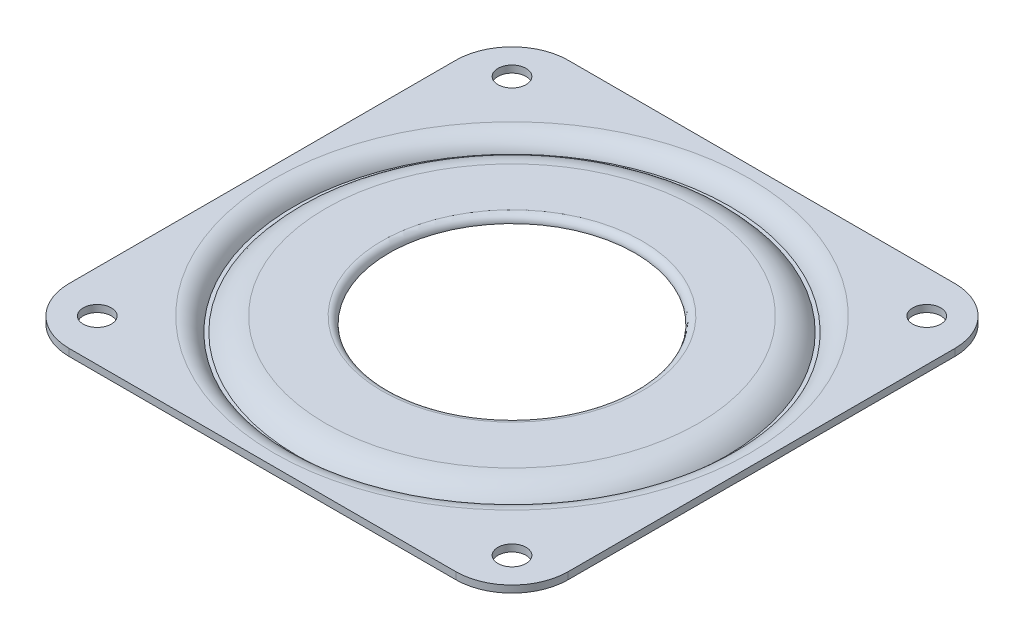
from build123d import *

# Parameters (mm, degrees)
SKETCH1_W           = 71
SKETCH1_H           = 71
SKETCH1_R           = 2
SKETCH1_R_2         = 17.5
BOSS_EXTRUDE1_DEPTH = 3
FILLET2_R           = 8
SKETCH2_R           = 31
SKETCH2_R_2         = 30.5
CUT_EXTRUDE1_DEPTH  = 2
FILLET3_R           = 5
FILLET4_R           = 3
FILLET5_R           = 1
SKETCH4_R           = 32.5
SKETCH4_R_2         = 2
SKETCH4_R_3         = 29
SKETCH4_R_4         = 17.5
CUT_EXTRUDE4_DEPTH  = 2
FILLET8_R           = 4
FILLET9_R           = 4


with BuildPart() as part:
    # Sketch1 → Boss-Extrude1 (new body)
    with BuildSketch(Plane(origin=(0, 0, 0), x_dir=(1, 0, 0), z_dir=(0, 1, 0))):
        with Locations((35.5, 35.5)):
            Rectangle(SKETCH1_W, SKETCH1_H)
        with Locations(Location((6, 6, 0), (0, 0, 270))):
            Circle(SKETCH1_R, mode=Mode.SUBTRACT)
        with Locations(Location((65, 6, 0), (0, 0, 270))):
            Circle(SKETCH1_R, mode=Mode.SUBTRACT)
        with Locations(Location((65, 65, 0), (0, 0, 270))):
            Circle(SKETCH1_R, mode=Mode.SUBTRACT)
        with Locations(Location((6, 65, 0), (0, 0, 270))):
            Circle(SKETCH1_R, mode=Mode.SUBTRACT)
        with Locations(Location((35.5, 35.5, 0), (0, 0, 270))):
            Circle(SKETCH1_R_2, mode=Mode.SUBTRACT)
    extrude(amount=BOSS_EXTRUDE1_DEPTH)

    # Fillet2
    fillet2_edges = [part.edges().sort_by_distance(p)[0] for p in [
        (0, 1.5, -71),
        (71, 1.5, -71),
        (71, 1.5, 0),
        (0, 1.5, 0),
    ]]
    fillet(fillet2_edges, radius=FILLET2_R)

    # Sketch2 → Cut-Extrude1 (cut)
    with BuildSketch(Plane(origin=(0, 3, 0), x_dir=(1, 0, 0), z_dir=(0, 1, 0))):
        with Locations(Location((35.5, 35.5, 0), (0, 0, 270))):
            Circle(SKETCH2_R)
        with Locations(Location((35.5, 35.5, 0), (0, 0, 270))):
            Circle(SKETCH2_R_2, mode=Mode.SUBTRACT)
    extrude(amount=-CUT_EXTRUDE1_DEPTH, mode=Mode.SUBTRACT)

    # Fillet3
    # the kernel refuses this fillet: 5 mm, written as the material it takes off along each edge
    with BuildSketch(Plane(origin=(35.5, 3, -35.5), x_dir=(0, 0, 1), z_dir=(-1, 0, 0))) as fillet3_piece_1:
        with BuildLine():
            CenterArc((26.5, -5), FILLET3_R, 36.869897646, 53.130102354)
            Line((30.5, -2), (30.58, -1.94))
            ThreePointArc((30.58, -1.94), (30.6, -1), (30.6, 0))
            Line((30.6, 0), (30.5, 0.1))
            Line((30.5, 0.1), (26.5, 0.1))
            Line((26.5, 0.1), (26.5, 0))
        make_face()
    revolve(axis=Axis((35.5, 3, -35.5), (0, 1, 0)), mode=Mode.SUBTRACT)

    # Fillet4
    # the kernel refuses this fillet: 3 mm, written as the material it takes off along each edge
    with BuildSketch(Plane(origin=(35.5, 3, -35.5), x_dir=(0, 0, 1), z_dir=(-1, 0, 0))) as fillet4_piece_1:
        with BuildLine():
            CenterArc((33.828427125, -3), FILLET4_R, 90, 70.528779366)
            Line((31, -2), (30.943431458, -1.98))
            ThreePointArc((30.943431458, -1.98), (30.94, -1), (30.94, 0))
            Line((30.94, 0), (31, 0.06))
            Line((31, 0.06), (33.828427125, 0.06))
            Line((33.828427125, 0.06), (33.828427125, 0))
        make_face()
    revolve(axis=Axis((35.5, 3, -35.5), (0, 1, 0)), mode=Mode.SUBTRACT)

    # Fillet5
    fillet5_edges = [part.edges().sort_by_distance(p)[0] for p in [
        (35.5, 3, -53),
    ]]
    fillet(fillet5_edges, radius=FILLET5_R)

    # Sketch4 → Cut-Extrude4 (cut)
    # profile 1 of 2: a face of its own
    with BuildSketch(Plane(origin=(0, 0, 0), x_dir=(-1, 0, 0), z_dir=(0, -1, 0))):
        with BuildLine():
            ThreePointArc((-8, 0), (-2.343145751, 2.343145751), (0, 8))
            Line((0, 8), (0, 63))
            ThreePointArc((0, 63), (-2.343145751, 68.656854249), (-8, 71))
            Line((-8, 71), (-63, 71))
            ThreePointArc((-63, 71), (-68.656854249, 68.656854249), (-71, 63))
            Line((-71, 63), (-71, 8))
            ThreePointArc((-71, 8), (-68.656854249, 2.343145751), (-63, 0))
            Line((-63, 0), (-8, 0))
        make_face()
        with Locations(Location((-35.5, 35.5, 0), (0, 0, 90))):
            Circle(SKETCH4_R, mode=Mode.SUBTRACT)
        with Locations(Location((-6, 6, 0), (0, 0, 90))):
            Circle(SKETCH4_R_2, mode=Mode.SUBTRACT)
        with Locations(Location((-6, 65, 0), (0, 0, 90))):
            Circle(SKETCH4_R_2, mode=Mode.SUBTRACT)
        with Locations(Location((-65, 6, 0), (0, 0, 90))):
            Circle(SKETCH4_R_2, mode=Mode.SUBTRACT)
        with Locations(Location((-65, 65, 0), (0, 0, 90))):
            Circle(SKETCH4_R_2, mode=Mode.SUBTRACT)
    # profile 2 of 2: a face of its own
    with BuildSketch(Plane(origin=(0, 0, 0), x_dir=(-1, 0, 0), z_dir=(0, -1, 0))):
        with Locations(Location((-35.5, 35.5, 0), (0, 0, 90))):
            Circle(SKETCH4_R_3)
        with Locations((-35.5, 35.5)):
            Circle(SKETCH4_R_4, mode=Mode.SUBTRACT)
    extrude(amount=-CUT_EXTRUDE4_DEPTH, mode=Mode.SUBTRACT)

    # Fillet8
    # the kernel refuses this fillet: 4 mm, written as the material it adds along each edge
    with BuildSketch(Plane(origin=(35.5, 2, -35.5), x_dir=(0, 0, -1), z_dir=(-1, 0, 0))) as fillet8_piece_1:
        with BuildLine():
            CenterArc((25.535898385, 4), FILLET8_R, 270, 60)
            Line((25.535898385, 0), (25.535898385, -0.08))
            Line((25.535898385, -0.08), (29, -0.08))
            Line((29, -0.08), (29.08, 0))
            ThreePointArc((29.08, 0), (29.08, 1), (29.069282032, 1.96))
            Line((29.069282032, 1.96), (29, 2))
        make_face()
    revolve(axis=Axis((35.5, 2, -35.5), (0, -1, 0)))

    # Fillet9
    # the kernel refuses this fillet: 4 mm, written as the material it adds along each edge
    with BuildSketch(Plane(origin=(35.5, 2, -35.5), x_dir=(0, 0, -1), z_dir=(-1, 0, 0))) as fillet9_piece_1_section:
        with BuildLine():
            CenterArc((35.964101615, 4), FILLET9_R, 210, 60)
            Line((35.964101615, 0), (35.964101615, -0.08))
            Line((35.964101615, -0.08), (32.5, -0.08))
            Line((32.5, -0.08), (32.42, 0))
            ThreePointArc((32.42, 0), (32.42, 1), (32.430717968, 1.96))
            Line((32.430717968, 1.96), (32.5, 2))
        make_face()
    fillet9_piece_1 = revolve(axis=Axis((35.5, 2, -35.5), (0, -1, 0)), mode=Mode.PRIVATE)
    fillet9_piece_1 = split(fillet9_piece_1, bisect_by=Plane(origin=(35.5, 1.533400125, 0), z_dir=(0, 0, -1)), keep=Keep.TOP, mode=Mode.PRIVATE)
    fillet9_piece_1 = split(fillet9_piece_1, bisect_by=Plane(origin=(0, 1.533400125, -1.575907898), z_dir=(1, 0, 0)), keep=Keep.TOP, mode=Mode.PRIVATE)
    fillet9_piece_1 = split(fillet9_piece_1, bisect_by=Plane(origin=(35.5, 1.533400125, -71), z_dir=(0, 0, 1)), keep=Keep.TOP, mode=Mode.PRIVATE)
    fillet9_piece_1 = split(fillet9_piece_1, bisect_by=Plane(origin=(71, 1.533400125, -1.575907898), z_dir=(-1, 0, 0)), keep=Keep.TOP, mode=Mode.PRIVATE)
    add(fillet9_piece_1)


solid = part.part
